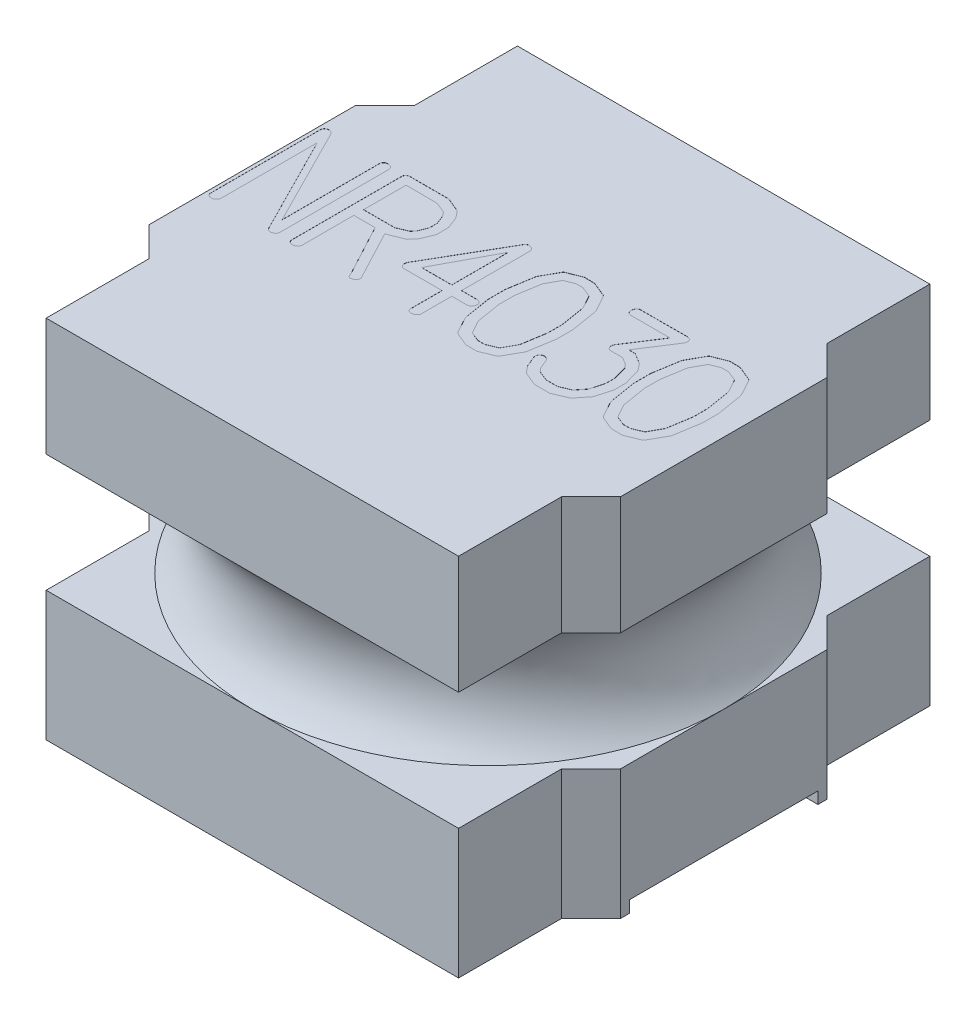
from build123d import *

# Parameters (mm, degrees)
BOSS_EXTRUDE1_START = -1.5
BOSS_EXTRUDE1_DEPTH = 1
CUT_EXTRUDE1_DEPTH  = 0.001
BOSS_EXTRUDE2_DEPTH = 0.1


with BuildPart() as part:
    # Sketch1 → Boss-Extrude1 (new body)
    with BuildSketch(Plane(origin=(0, 0, 0), x_dir=(1, 0, 0), z_dir=(0, 1, 0)).offset(BOSS_EXTRUDE1_START)):
        Polygon((-1.75, 2), (1.75, 2), (1.75, 1.125), (2, 0.875), (2, -0.875), (1.75, -1.125), (1.75, -2), (-1.75, -2), (-1.75, -1.125), (-2, -0.875), (-2, 0.875), (-1.75, 1.125), align=None)
    boss_extrude1 = extrude(amount=BOSS_EXTRUDE1_DEPTH)

    # Sketch2 → Revolve1 (revolve)
    with BuildSketch(Plane(origin=(0, 0, 0), x_dir=(0, 0, -1), z_dir=(1, 0, 0))):
        with BuildLine():
            Line((-2, 0.5), (0, 0.5))
            Line((0, 0.5), (0, -0.5))
            Line((0, -0.5), (-2, -0.5))
            ThreePointArc((-2, -0.5), (-1.809016994, 0), (-2, 0.5))
        make_face()
    revolve(axis=Axis((0, -1.5, 0), (0, 1, 0)))

    # Mirror1: Boss-Extrude1 across plane
    add(boss_extrude1.mirror(Plane.ZX))

    # Sketch3 → Cut-Extrude1 (cut)
    # profile 1 of 6: a face of its own
    with BuildSketch(Plane(origin=(0, 1.5, 0), x_dir=(1, 0, 0), z_dir=(0, 1, 0))):
        with BuildLine():
            Line((-1.896763393, 0.565182545), (-1.47172619, -0.275777276))
            Line((-1.47172619, -0.275777276), (-1.47172619, 0.556439986))
            add(Edge.make_bspline(
                [(-1.47172619, 0.556439986), (-1.470306395, 0.560142119), (-1.467630722, 0.567118969), (-1.460760161, 0.575623855), (-1.452434536, 0.581976469), (-1.445838877, 0.583797906), (-1.442522321, 0.584713795)],
                knots=[0, 0, 0, 0, 1.109185066, 2.09031286, 3.039734632, 4, 4, 4, 4], degree=3))
            add(Edge.make_bspline(
                [(-1.442522321, 0.584713795), (-1.436038113, 0.584478157), (-1.424379293, 0.584054471), (-1.408951724, 0.580032187), (-1.397195814, 0.572686768), (-1.393633727, 0.565223886), (-1.391927083, 0.561648319)],
                knots=[0, 0, 0, 0, 1.309736388, 2.354949205, 3.211834253, 4, 4, 4, 4], degree=3))
            Line((-1.391927083, 0.561648319), (-1.388392857, 0.549557545))
            Line((-1.388392857, 0.549557545), (-1.388392857, -0.383478169))
            add(Edge.make_bspline(
                [(-1.388392857, -0.383478169), (-1.389803322, -0.387527534), (-1.392568979, -0.395467575), (-1.401548089, -0.405193133), (-1.413923051, -0.411867685), (-1.423471144, -0.414095942), (-1.428571429, -0.415286205)],
                knots=[0, 0, 0, 0, 0.93883371, 1.840875961, 2.846665492, 4, 4, 4, 4], degree=3))
            add(Edge.make_bspline(
                [(-1.428571429, -0.415286205), (-1.432188471, -0.415176507), (-1.438883743, -0.414973452), (-1.447870125, -0.412720635), (-1.455385705, -0.409366324), (-1.458511029, -0.405444995), (-1.46000744, -0.403567455)],
                knots=[0, 0, 0, 0, 1.240813366, 2.296788812, 3.184498919, 4, 4, 4, 4], degree=3))
            Line((-1.46000744, -0.403567455), (-1.466517857, -0.394452871))
            Line((-1.466517857, -0.394452871), (-1.888392857, 0.439066474))
            Line((-1.888392857, 0.439066474), (-1.888392857, -0.381804062))
            add(Edge.make_bspline(
                [(-1.888392857, -0.381804062), (-1.889479385, -0.384979641), (-1.891736312, -0.391575932), (-1.898454551, -0.400472129), (-1.907811787, -0.408500211), (-1.915283117, -0.412924698), (-1.919270833, -0.415286205)],
                knots=[0, 0, 0, 0, 0.855881606, 1.777831308, 2.813949167, 4, 4, 4, 4], degree=3))
            Line((-1.919270833, -0.415286205), (-1.936011905, -0.415286205))
            add(Edge.make_bspline(
                [(-1.936011905, -0.415286205), (-1.938636346, -0.415227468), (-1.943726483, -0.415113546), (-1.950770904, -0.41286715), (-1.957229509, -0.410001889), (-1.962385618, -0.405405544), (-1.966543861, -0.399955988), (-1.969492153, -0.393737282), (-1.971498185, -0.386887024), (-1.971648412, -0.382067298), (-1.97172619, -0.379571919)],
                knots=[0, 0, 0, 0, 1.101665817, 2.136695196, 3.096220978, 4.06108244, 5.013447482, 5.972973263, 6.950521542, 8, 8, 8, 8], degree=3))
            Line((-1.97172619, -0.379571919), (-1.97172619, 0.554765879))
            add(Edge.make_bspline(
                [(-1.97172619, 0.554765879), (-1.970424232, 0.558274857), (-1.967871956, 0.56515363), (-1.960801213, 0.573792575), (-1.951543686, 0.58051624), (-1.944281464, 0.583270574), (-1.94047619, 0.584713795)],
                knots=[0, 0, 0, 0, 0.990101851, 1.940931574, 2.921085177, 4, 4, 4, 4], degree=3))
            add(Edge.make_bspline(
                [(-1.94047619, 0.584713795), (-1.936111566, 0.584449349), (-1.927664385, 0.583937548), (-1.915640252, 0.580381328), (-1.905043333, 0.574120683), (-1.899546284, 0.568186656), (-1.896763393, 0.565182545)],
                knots=[0, 0, 0, 0, 1.057654734, 2.046957308, 3.011268782, 4, 4, 4, 4], degree=3))
        make_face()
    # profile 2 of 6: a face of its own
    with BuildSketch(Plane(origin=(0, 1.5, 0), x_dir=(1, 0, 0), z_dir=(0, 1, 0))):
        with BuildLine():
            add(Edge.make_bspline(
                [(-0.916220238, 0.584713795), (-0.912819184, 0.583142877), (-0.905559586, 0.579789729), (-0.89386605, 0.574930794), (-0.881004782, 0.569184691), (-0.866662817, 0.563360852), (-0.851012308, 0.556763425), (-0.833973993, 0.54981334), (-0.815704558, 0.542046263), (-0.803010382, 0.53694798), (-0.796428571, 0.534304569)],
                knots=[0, 0, 0, 0, 0.69170389, 1.476452024, 2.33788276, 3.292567323, 4.33444127, 5.47407891, 6.69033371, 8, 8, 8, 8], degree=3))
            add(Edge.make_bspline(
                [(-0.796428571, 0.534304569), (-0.795365255, 0.533196905), (-0.792871733, 0.530599387), (-0.788930193, 0.52599228), (-0.783955072, 0.520404772), (-0.778535116, 0.513460678), (-0.771870613, 0.505651651), (-0.764518356, 0.496576426), (-0.75632609, 0.48635153), (-0.750662632, 0.479126604), (-0.747693452, 0.475338795)],
                knots=[0, 0, 0, 0, 0.481485898, 1.129104191, 1.901129329, 2.827469681, 3.890672923, 5.120764969, 6.490504369, 8, 8, 8, 8], degree=3))
            Line((-0.747693452, 0.475338795), (-0.708630952, 0.375636414))
            add(Edge.make_bspline(
                [(-0.708630952, 0.375636414), (-0.708442783, 0.369250132), (-0.708022631, 0.354990646), (-0.707378502, 0.33130738), (-0.707353284, 0.303153309), (-0.707216213, 0.282878298), (-0.707142857, 0.272027783)],
                knots=[0, 0, 0, 0, 0.739877275, 1.652020808, 2.743439316, 4, 4, 4, 4], degree=3))
            add(Edge.make_bspline(
                [(-0.707142857, 0.272027783), (-0.708833753, 0.268066448), (-0.712414149, 0.259678499), (-0.7177127, 0.246282734), (-0.723686208, 0.231596438), (-0.729956446, 0.216247789), (-0.735895517, 0.2014471), (-0.740808214, 0.188334392), (-0.745137178, 0.177862838), (-0.747576349, 0.171646102), (-0.748623512, 0.168977188)],
                knots=[0, 0, 0, 0, 0.930477767, 1.970244378, 3.112005238, 4.355764031, 5.552241039, 6.557257016, 7.380614275, 8, 8, 8, 8], degree=3))
            Line((-0.748623512, 0.168977188), (-0.796056548, 0.112615581))
            Line((-0.796056548, 0.112615581), (-0.802380952, 0.108523319))
            Line((-0.802380952, 0.108523319), (-0.918452381, 0.060904271))
            Line((-0.918452381, 0.060904271), (-0.93500744, 0.060904271))
            Line((-0.93500744, 0.060904271), (-0.71235119, -0.359668645))
            add(Edge.make_bspline(
                [(-0.71235119, -0.359668645), (-0.710840542, -0.362518567), (-0.708167134, -0.367562101), (-0.70745332, -0.373209441), (-0.707142857, -0.375665669)],
                knots=[0, 0, 0, 0, 1.130128936, 2, 2, 2, 2], degree=3))
            add(Edge.make_bspline(
                [(-0.707142857, -0.375665669), (-0.707288041, -0.379102057), (-0.707558426, -0.385501872), (-0.710834301, -0.390984218), (-0.71235119, -0.393522812)],
                knots=[0, 0, 0, 0, 1.073902397, 2, 2, 2, 2], degree=3))
            add(Edge.make_bspline(
                [(-0.71235119, -0.393522812), (-0.714349654, -0.396902888), (-0.718452493, -0.403842171), (-0.729761392, -0.410547182), (-0.743987225, -0.414627787), (-0.754660614, -0.414932615), (-0.760528274, -0.415100193)],
                knots=[0, 0, 0, 0, 0.833397318, 1.710961782, 2.741608977, 4, 4, 4, 4], degree=3))
            add(Edge.make_bspline(
                [(-0.760528274, -0.415100193), (-0.763007493, -0.413961421), (-0.768484487, -0.41144569), (-0.774695764, -0.403152782), (-0.780230676, -0.39201179), (-0.7828736, -0.383168872), (-0.784337798, -0.378269836)],
                knots=[0, 0, 0, 0, 0.710807694, 1.570288236, 2.65392335, 4, 4, 4, 4], degree=3))
            Line((-0.784337798, -0.378269836), (-1.019084821, 0.060904271))
            Line((-1.019084821, 0.060904271), (-1.199702381, 0.060904271))
            Line((-1.199702381, 0.060904271), (-1.199702381, -0.381990074))
            add(Edge.make_bspline(
                [(-1.199702381, -0.381990074), (-1.200703143, -0.385179467), (-1.202800313, -0.391863072), (-1.209811821, -0.400575425), (-1.219115439, -0.408814022), (-1.226813628, -0.413023225), (-1.230952381, -0.415286205)],
                knots=[0, 0, 0, 0, 0.845387553, 1.771571109, 2.801936792, 4, 4, 4, 4], degree=3))
            Line((-1.230952381, -0.415286205), (-1.247321429, -0.415286205))
            add(Edge.make_bspline(
                [(-1.247321429, -0.415286205), (-1.24994587, -0.415227468), (-1.255036007, -0.415113546), (-1.262080428, -0.41286715), (-1.268539033, -0.410001889), (-1.273695142, -0.405405544), (-1.277853385, -0.399955988), (-1.280801676, -0.393737282), (-1.282807708, -0.386887024), (-1.282957935, -0.382067298), (-1.283035714, -0.379571919)],
                knots=[0, 0, 0, 0, 1.101665817, 2.136695196, 3.096220978, 4.06108244, 5.013447482, 5.972973263, 6.950521542, 8, 8, 8, 8], degree=3))
            Line((-1.283035714, -0.379571919), (-1.283035714, 0.55588195))
            add(Edge.make_bspline(
                [(-1.283035714, 0.55588195), (-1.281821214, 0.559642222), (-1.279498142, 0.566834794), (-1.272703477, 0.575716703), (-1.263696193, 0.582136738), (-1.256595062, 0.583832062), (-1.252901786, 0.584713795)],
                knots=[0, 0, 0, 0, 1.064767976, 2.036666745, 2.978876548, 4, 4, 4, 4], degree=3))
            Line((-1.252901786, 0.584713795), (-0.916220238, 0.584713795))
        make_face()
        Polygon((-0.843861607, 0.466224212), (-0.934077381, 0.503054569), (-1.199702381, 0.504356652), (-1.199702381, 0.144237605), (-0.935379464, 0.144237605), (-0.843861607, 0.183300105), (-0.818377976, 0.214178081), (-0.787686012, 0.289698914), (-0.787686012, 0.357593259), (-0.818377976, 0.433114093), align=None, mode=Mode.SUBTRACT)
    # profile 3 of 6: a face of its own
    with BuildSketch(Plane(origin=(0, 1.5, 0), x_dir=(1, 0, 0), z_dir=(0, 1, 0))):
        with BuildLine():
            Line((-0.194233631, 0.561648319), (-0.189583333, 0.548813498))
            Line((-0.189583333, 0.548813498), (-0.189583333, -0.034333824))
            Line((-0.189583333, -0.034333824), (-0.055654762, -0.034519836))
            add(Edge.make_bspline(
                [(-0.055654762, -0.034519836), (-0.0505191, -0.035845237), (-0.04111382, -0.038272532), (-0.029358132, -0.045828156), (-0.021335425, -0.0563029), (-0.019798957, -0.064648792), (-0.019010417, -0.068932038)],
                knots=[0, 0, 0, 0, 1.169459646, 2.1417093, 3.046295384, 4, 4, 4, 4], degree=3))
            add(Edge.make_bspline(
                [(-0.019010417, -0.068932038), (-0.019167329, -0.072921736), (-0.019468311, -0.080574575), (-0.022363141, -0.091357533), (-0.026905325, -0.101037212), (-0.031695085, -0.106056245), (-0.034077381, -0.108552574)],
                knots=[0, 0, 0, 0, 1.095690159, 2.101697989, 3.055836587, 4, 4, 4, 4], degree=3))
            Line((-0.034077381, -0.108552574), (-0.051934524, -0.117667157))
            Line((-0.051934524, -0.117667157), (-0.189583333, -0.117667157))
            Line((-0.189583333, -0.117667157), (-0.189583333, -0.38161805))
            add(Edge.make_bspline(
                [(-0.189583333, -0.38161805), (-0.190501795, -0.384590956), (-0.19227155, -0.390319359), (-0.197093909, -0.397779375), (-0.203390314, -0.403784099), (-0.213173772, -0.40882583), (-0.224427688, -0.413148332), (-0.233393179, -0.414648726), (-0.237202381, -0.415286205)],
                knots=[0, 0, 0, 0, 0.895387976, 1.725295879, 2.536428694, 3.378620822, 4.886244683, 6, 6, 6, 6], degree=3))
            add(Edge.make_bspline(
                [(-0.237202381, -0.415286205), (-0.24000098, -0.415192141), (-0.245283265, -0.415014598), (-0.252686607, -0.413360266), (-0.258920132, -0.410530043), (-0.264244805, -0.406754867), (-0.26812442, -0.401568245), (-0.271025447, -0.395380956), (-0.272624796, -0.388083341), (-0.272816283, -0.382865378), (-0.272916667, -0.380129955)],
                knots=[0, 0, 0, 0, 1.168965484, 2.206392299, 3.145950951, 4.016860765, 4.903443245, 5.819468469, 6.856895284, 8, 8, 8, 8], degree=3))
            Line((-0.272916667, -0.380129955), (-0.272916667, -0.117667157))
            Line((-0.272916667, -0.117667157), (-0.600855655, -0.117667157))
            add(Edge.make_bspline(
                [(-0.600855655, -0.117667157), (-0.60441803, -0.116705645), (-0.611342046, -0.114836799), (-0.620277979, -0.108291522), (-0.626486277, -0.098628148), (-0.62881918, -0.091141604), (-0.630059524, -0.087161205)],
                knots=[0, 0, 0, 0, 0.981167136, 1.907046662, 2.887231297, 4, 4, 4, 4], degree=3))
            Line((-0.630059524, -0.087161205), (-0.630059524, -0.077674598))
            add(Edge.make_bspline(
                [(-0.630059524, -0.077674598), (-0.629803534, -0.073068197), (-0.629294815, -0.063914094), (-0.625207591, -0.055709114), (-0.623177083, -0.051632931)],
                knots=[0, 0, 0, 0, 1.00641232, 2, 2, 2, 2], degree=3))
            Line((-0.623177083, -0.051632931), (-0.580766369, 0.020911712))
            Line((-0.580766369, 0.020911712), (-0.261755952, 0.572437009))
            add(Edge.make_bspline(
                [(-0.261755952, 0.572437009), (-0.259564783, 0.5742872), (-0.255479413, 0.577736826), (-0.249078974, 0.581859249), (-0.242633996, 0.584225878), (-0.238334685, 0.584555619), (-0.236272321, 0.584713795)],
                knots=[0, 0, 0, 0, 1.18923455, 2.217292782, 3.144841935, 4, 4, 4, 4], degree=3))
            add(Edge.make_bspline(
                [(-0.236272321, 0.584713795), (-0.234404977, 0.5845061), (-0.230576814, 0.584080314), (-0.226839751, 0.583146151), (-0.224925595, 0.582667664)],
                knots=[0, 0, 0, 0, 0.975582543, 2, 2, 2, 2], degree=3))
            add(Edge.make_bspline(
                [(-0.224925595, 0.582667664), (-0.220883993, 0.581673517), (-0.213537628, 0.579866468), (-0.204408508, 0.574859942), (-0.197380358, 0.569136499), (-0.195246675, 0.564059032), (-0.194233631, 0.561648319)],
                knots=[0, 0, 0, 0, 1.277997596, 2.322998947, 3.203782403, 4, 4, 4, 4], degree=3))
        make_face()
        Polygon((-0.527938988, -0.034333824), (-0.272916667, -0.034333824), (-0.272916667, 0.444460819), align=None, mode=Mode.SUBTRACT)
    # profile 4 of 6: a face of its own
    with BuildSketch(Plane(origin=(0, 1.5, 0), x_dir=(1, 0, 0), z_dir=(0, 1, 0))):
        with BuildLine():
            add(Edge.make_bspline(
                [(0.322767857, 0.583039688), (0.326173058, 0.581539845), (0.333519924, 0.57830387), (0.345352397, 0.573403138), (0.358592366, 0.567664507), (0.373482234, 0.561912306), (0.389655505, 0.555102658), (0.407338652, 0.547784533), (0.426678355, 0.540329583), (0.439965264, 0.534887365), (0.446837798, 0.532072426)],
                knots=[0, 0, 0, 0, 0.665720275, 1.436320058, 2.291406459, 3.247277281, 4.291804095, 5.431067394, 6.671242782, 8, 8, 8, 8], degree=3))
            Line((0.446837798, 0.532072426), (0.458928571, 0.517563498))
            Line((0.458928571, 0.517563498), (0.530543155, 0.384937009))
            Line((0.530543155, 0.384937009), (0.534635417, 0.370986117))
            Line((0.534635417, 0.370986117), (0.570535714, 0.150189986))
            Line((0.570535714, 0.150189986), (0.570535714, 0.012727188))
            Line((0.570535714, 0.012727188), (0.533333333, -0.213463288))
            Line((0.533333333, -0.213463288), (0.530357143, -0.21755555))
            Line((0.530357143, -0.21755555), (0.451116071, -0.35911061))
            Line((0.451116071, -0.35911061), (0.443861607, -0.365249002))
            add(Edge.make_bspline(
                [(0.443861607, -0.365249002), (0.439383629, -0.36676168), (0.429864848, -0.369977158), (0.41494761, -0.375927253), (0.398238292, -0.382547328), (0.380533743, -0.389936864), (0.363037839, -0.39729067), (0.347226445, -0.404193145), (0.33350565, -0.409898418), (0.325241332, -0.413596661), (0.321465774, -0.415286205)],
                knots=[0, 0, 0, 0, 0.857514317, 1.822807192, 2.913398912, 4.118988428, 5.303819582, 6.357154914, 7.249465436, 8, 8, 8, 8], degree=3))
            Line((0.321465774, -0.415286205), (0.228087798, -0.415286205))
            add(Edge.make_bspline(
                [(0.228087798, -0.415286205), (0.220569275, -0.412411992), (0.203961657, -0.406063162), (0.177016278, -0.394651666), (0.145230402, -0.381628066), (0.12260421, -0.371918981), (0.110528274, -0.366737098)],
                knots=[0, 0, 0, 0, 0.759314602, 1.677245352, 2.760311232, 4, 4, 4, 4], degree=3))
            Line((0.110528274, -0.366737098), (0.100111607, -0.356134419))
            Line((0.100111607, -0.356134419), (0.025892857, -0.218113586))
            Line((0.025892857, -0.218113586), (0.023102679, -0.207882931))
            Line((0.023102679, -0.207882931), (-0.012797619, 0.014773319))
            Line((-0.012797619, 0.014773319), (-0.012797619, 0.159490581))
            Line((-0.012797619, 0.159490581), (0.023474702, 0.382146831))
            Line((0.023474702, 0.382146831), (0.02719494, 0.39181945))
            Line((0.02719494, 0.39181945), (0.102529762, 0.527050105))
            Line((0.102529762, 0.527050105), (0.112388393, 0.536722724))
            add(Edge.make_bspline(
                [(0.112388393, 0.536722724), (0.116307082, 0.538053111), (0.124947841, 0.540986631), (0.138756573, 0.546577625), (0.155077767, 0.552543385), (0.17269281, 0.559762622), (0.190316997, 0.567220509), (0.206694697, 0.573528655), (0.220684727, 0.579441596), (0.229323774, 0.582925729), (0.233296131, 0.584527783)],
                knots=[0, 0, 0, 0, 0.76366452, 1.683889708, 2.748731425, 3.970665397, 5.196932387, 6.280730219, 7.209455205, 8, 8, 8, 8], degree=3))
            Line((0.233296131, 0.584527783), (0.322767857, 0.583039688))
        make_face()
        Polygon((0.39140625, 0.466968259), (0.30453869, 0.501380462), (0.245572917, 0.501380462), (0.165215774, 0.468642367), (0.103831845, 0.357407248), (0.070535714, 0.15260814), (0.070535714, 0.021841771), (0.104947917, -0.187049598), (0.166331845, -0.299400788), (0.245386905, -0.331952871), (0.303980655, -0.331952871), (0.392522321, -0.294936502), (0.454092262, -0.183515371), (0.487202381, 0.021841771), (0.487202381, 0.142563498), (0.45297619, 0.354059033), align=None, mode=Mode.SUBTRACT)
    # profile 5 of 6: a face of its own
    with BuildSketch(Plane(origin=(0, 1.5, 0), x_dir=(1, 0, 0), z_dir=(0, 1, 0))):
        with BuildLine():
            add(Edge.make_bspline(
                [(1.146130952, 0.545465283), (1.145966982, 0.543463528), (1.145598806, 0.538968833), (1.142876033, 0.531946606), (1.138973509, 0.523915999), (1.135527522, 0.518460835), (1.133668155, 0.515517367)],
                knots=[0, 0, 0, 0, 0.731496768, 1.642485333, 2.72794448, 4, 4, 4, 4], degree=3))
            add(Edge.make_bspline(
                [(1.133668155, 0.515517367), (1.131679496, 0.512354181), (1.128392186, 0.507125346), (1.126340565, 0.503939229), (1.122508292, 0.497825042), (1.123371227, 0.498708449), (1.1234375, 0.498776295)],
                knots=[0, 0, 0, 0, 2.008375184, 3.31990065, 3.947768297, 4, 4, 4, 4], degree=3))
            Line((1.1234375, 0.498776295), (0.955840774, 0.2394757))
            Line((0.955840774, 0.2394757), (1.00922619, 0.2394757))
            add(Edge.make_bspline(
                [(1.00922619, 0.2394757), (1.014874125, 0.236136807), (1.027442324, 0.228706856), (1.048111917, 0.216177336), (1.072622951, 0.201288147), (1.090321772, 0.190669302), (1.099813988, 0.184974212)],
                knots=[0, 0, 0, 0, 0.744723836, 1.65721417, 2.743519113, 4, 4, 4, 4], degree=3))
            Line((1.099813988, 0.184974212), (1.13999256, 0.136053081))
            add(Edge.make_bspline(
                [(1.13999256, 0.136053081), (1.141094935, 0.134531506), (1.143697635, 0.130939082), (1.146767237, 0.123979408), (1.1504111, 0.115234897), (1.15245495, 0.108608723), (1.153571429, 0.104989093)],
                knots=[0, 0, 0, 0, 0.660434001, 1.559278996, 2.666725834, 4, 4, 4, 4], degree=3))
            add(Edge.make_bspline(
                [(1.153571429, 0.104989093), (1.155674377, 0.097423155), (1.16034781, 0.080609187), (1.168202323, 0.052843165), (1.17749544, 0.019916962), (1.184199629, -0.003766363), (1.187797619, -0.016476681)],
                knots=[0, 0, 0, 0, 0.746719963, 1.659454107, 2.743880703, 4, 4, 4, 4], degree=3))
            Line((1.187797619, -0.016476681), (1.187797619, -0.115435014))
            add(Edge.make_bspline(
                [(1.187797619, -0.115435014), (1.183981622, -0.128880564), (1.176691243, -0.154567995), (1.166787961, -0.191471332), (1.157492077, -0.224747523), (1.152051218, -0.245882764), (1.149479167, -0.255874002)],
                knots=[0, 0, 0, 0, 1.152088605, 2.201040242, 3.149579839, 4, 4, 4, 4], degree=3))
            add(Edge.make_bspline(
                [(1.149479167, -0.255874002), (1.148307478, -0.257490819), (1.145345512, -0.261578044), (1.139781751, -0.26878772), (1.13200663, -0.27823063), (1.122713436, -0.290451238), (1.110763051, -0.304562996), (1.097603618, -0.321703154), (1.081819807, -0.34069679), (1.070839086, -0.354320941), (1.065029762, -0.361528764)],
                knots=[0, 0, 0, 0, 0.354260306, 0.895550937, 1.615424868, 2.52432519, 3.618802696, 4.895348182, 6.357491474, 8, 8, 8, 8], degree=3))
            add(Edge.make_bspline(
                [(1.065029762, -0.361528764), (1.060515732, -0.36366402), (1.050930409, -0.368198131), (1.035375925, -0.37484548), (1.017979567, -0.382107947), (0.999316539, -0.389396593), (0.980982174, -0.396451597), (0.964686447, -0.40331462), (0.950984084, -0.409468379), (0.942811076, -0.413469356), (0.939099702, -0.415286205)],
                knots=[0, 0, 0, 0, 0.874918988, 1.85784809, 2.963529072, 4.178080018, 5.368433221, 6.405587914, 7.27597554, 8, 8, 8, 8], degree=3))
            Line((0.939099702, -0.415286205), (0.808891369, -0.415286205))
            add(Edge.make_bspline(
                [(0.808891369, -0.415286205), (0.80162127, -0.412472525), (0.785512274, -0.406238008), (0.759311799, -0.39501506), (0.728268688, -0.382178249), (0.706136242, -0.372600021), (0.694308036, -0.367481145)],
                knots=[0, 0, 0, 0, 0.753366235, 1.669299668, 2.754407724, 4, 4, 4, 4], degree=3))
            add(Edge.make_bspline(
                [(0.694308036, -0.367481145), (0.693486673, -0.366752221), (0.691416109, -0.364914684), (0.688196758, -0.361066912), (0.683628916, -0.356078826), (0.678140798, -0.349547589), (0.671426694, -0.341751415), (0.663569559, -0.33261239), (0.654701117, -0.322072569), (0.648480483, -0.314535259), (0.645200893, -0.310561502)],
                knots=[0, 0, 0, 0, 0.350081131, 0.882515176, 1.597343563, 2.509514018, 3.604118565, 4.881157203, 6.35571015, 8, 8, 8, 8], degree=3))
            Line((0.645200893, -0.310561502), (0.604464286, -0.213835312))
            Line((0.604464286, -0.213835312), (0.604464286, -0.203418645))
            add(Edge.make_bspline(
                [(0.604464286, -0.203418645), (0.604783998, -0.198378384), (0.605390145, -0.18882248), (0.6105721, -0.180797268), (0.613020833, -0.177004955)],
                knots=[0, 0, 0, 0, 1.054899985, 2, 2, 2, 2], degree=3))
            add(Edge.make_bspline(
                [(0.613020833, -0.177004955), (0.615484388, -0.174962741), (0.620435161, -0.170858695), (0.629456985, -0.166810099), (0.6394831, -0.16431489), (0.646548635, -0.164097289), (0.650223214, -0.163984121)],
                knots=[0, 0, 0, 0, 0.947468225, 1.904037492, 2.909950893, 4, 4, 4, 4], degree=3))
            add(Edge.make_bspline(
                [(0.650223214, -0.163984121), (0.654167331, -0.16557506), (0.661437519, -0.168507636), (0.670865793, -0.173685002), (0.677744265, -0.179774907), (0.680287127, -0.18460885), (0.681473214, -0.186863586)],
                knots=[0, 0, 0, 0, 1.28205388, 2.363209, 3.236538274, 4, 4, 4, 4], degree=3))
            Line((0.681473214, -0.186863586), (0.715885417, -0.269452871))
            Line((0.715885417, -0.269452871), (0.741741071, -0.298656741))
            Line((0.741741071, -0.298656741), (0.825074405, -0.331952871))
            Line((0.825074405, -0.331952871), (0.921056548, -0.331952871))
            Line((0.921056548, -0.331952871), (1.012202381, -0.294192455))
            Line((1.012202381, -0.294192455), (1.072098214, -0.220903764))
            Line((1.072098214, -0.220903764), (1.104464286, -0.102972217))
            Line((1.104464286, -0.102972217), (1.104464286, -0.027823407))
            Line((1.104464286, -0.027823407), (1.072842262, 0.088248021))
            Line((1.072842262, 0.088248021), (1.045126488, 0.120614093))
            Line((1.045126488, 0.120614093), (0.985602679, 0.156142367))
            Line((0.985602679, 0.156142367), (0.879575893, 0.156142367))
            add(Edge.make_bspline(
                [(0.879575893, 0.156142367), (0.875780938, 0.157371714), (0.868398763, 0.159763115), (0.859661952, 0.167748587), (0.85380116, 0.17841488), (0.85241469, 0.186570347), (0.851674107, 0.190926593)],
                knots=[0, 0, 0, 0, 0.993260278, 1.932149966, 2.895457034, 4, 4, 4, 4], degree=3))
            add(Edge.make_bspline(
                [(0.851674107, 0.190926593), (0.851758519, 0.196174182), (0.851907411, 0.205430218), (0.855898217, 0.213741133), (0.857626488, 0.217340283)],
                knots=[0, 0, 0, 0, 1.133873875, 2, 2, 2, 2], degree=3))
            Line((0.857626488, 0.217340283), (1.041964286, 0.501380462))
            Line((1.041964286, 0.501380462), (0.703980655, 0.501380462))
            add(Edge.make_bspline(
                [(0.703980655, 0.501380462), (0.700479643, 0.502415304), (0.693604631, 0.504447447), (0.684743659, 0.511150916), (0.67846783, 0.521005042), (0.676304048, 0.528705313), (0.67514881, 0.532816474)],
                knots=[0, 0, 0, 0, 0.961552233, 1.888220791, 2.872524955, 4, 4, 4, 4], degree=3))
            add(Edge.make_bspline(
                [(0.67514881, 0.532816474), (0.675331973, 0.537925971), (0.675671285, 0.547391371), (0.678893736, 0.560381971), (0.683923761, 0.571314117), (0.689302235, 0.576593477), (0.691889881, 0.579133438)],
                knots=[0, 0, 0, 0, 1.204793626, 2.231893546, 3.149343424, 4, 4, 4, 4], degree=3))
            Line((0.691889881, 0.579133438), (0.703050595, 0.5832257))
            Line((0.703050595, 0.5832257), (1.095349702, 0.584713795))
            add(Edge.make_bspline(
                [(1.095349702, 0.584713795), (1.099325852, 0.584637454), (1.106771215, 0.584494505), (1.117200648, 0.582657804), (1.126072565, 0.579497122), (1.133480781, 0.575246819), (1.139438302, 0.569679813), (1.143264993, 0.562538599), (1.145821127, 0.554381007), (1.14602462, 0.548525174), (1.146130952, 0.545465283)],
                knots=[0, 0, 0, 0, 1.302296161, 2.438557397, 3.454453739, 4.374755197, 5.222865942, 6.087619718, 7.000710084, 8, 8, 8, 8], degree=3))
        make_face()
    # profile 6 of 6: a face of its own
    with BuildSketch(Plane(origin=(0, 1.5, 0), x_dir=(1, 0, 0), z_dir=(0, 1, 0))):
        with BuildLine():
            add(Edge.make_bspline(
                [(1.557291667, 0.583039688), (1.560696867, 0.581539845), (1.568043734, 0.57830387), (1.579876207, 0.573403138), (1.593116175, 0.567664507), (1.608006044, 0.561912306), (1.624179314, 0.555102658), (1.641862461, 0.547784533), (1.661202164, 0.540329583), (1.674489073, 0.534887365), (1.681361607, 0.532072426)],
                knots=[0, 0, 0, 0, 0.665720275, 1.436320058, 2.291406459, 3.247277281, 4.291804095, 5.431067394, 6.671242782, 8, 8, 8, 8], degree=3))
            Line((1.681361607, 0.532072426), (1.693452381, 0.517563498))
            Line((1.693452381, 0.517563498), (1.765066964, 0.384937009))
            Line((1.765066964, 0.384937009), (1.769159226, 0.370986117))
            Line((1.769159226, 0.370986117), (1.805059524, 0.150189986))
            Line((1.805059524, 0.150189986), (1.805059524, 0.012727188))
            Line((1.805059524, 0.012727188), (1.767857143, -0.213463288))
            Line((1.767857143, -0.213463288), (1.764880952, -0.21755555))
            Line((1.764880952, -0.21755555), (1.685639881, -0.35911061))
            Line((1.685639881, -0.35911061), (1.678385417, -0.365249002))
            add(Edge.make_bspline(
                [(1.678385417, -0.365249002), (1.673907438, -0.36676168), (1.664388658, -0.369977158), (1.64947142, -0.375927253), (1.632762102, -0.382547328), (1.615057552, -0.389936864), (1.597561649, -0.39729067), (1.581750255, -0.404193145), (1.568029459, -0.409898418), (1.559765141, -0.413596661), (1.555989583, -0.415286205)],
                knots=[0, 0, 0, 0, 0.857514317, 1.822807192, 2.913398912, 4.118988428, 5.303819582, 6.357154914, 7.249465436, 8, 8, 8, 8], degree=3))
            Line((1.555989583, -0.415286205), (1.462611607, -0.415286205))
            add(Edge.make_bspline(
                [(1.462611607, -0.415286205), (1.455093085, -0.412411992), (1.438485467, -0.406063162), (1.411540087, -0.394651666), (1.379754212, -0.381628066), (1.357128019, -0.371918981), (1.345052083, -0.366737098)],
                knots=[0, 0, 0, 0, 0.759314602, 1.677245352, 2.760311232, 4, 4, 4, 4], degree=3))
            Line((1.345052083, -0.366737098), (1.334635417, -0.356134419))
            Line((1.334635417, -0.356134419), (1.260416667, -0.218113586))
            Line((1.260416667, -0.218113586), (1.257626488, -0.207882931))
            Line((1.257626488, -0.207882931), (1.22172619, 0.014773319))
            Line((1.22172619, 0.014773319), (1.22172619, 0.159490581))
            Line((1.22172619, 0.159490581), (1.257998512, 0.382146831))
            Line((1.257998512, 0.382146831), (1.26171875, 0.39181945))
            Line((1.26171875, 0.39181945), (1.337053571, 0.527050105))
            Line((1.337053571, 0.527050105), (1.346912202, 0.536722724))
            add(Edge.make_bspline(
                [(1.346912202, 0.536722724), (1.350830892, 0.538053111), (1.359471651, 0.540986631), (1.373280382, 0.546577625), (1.389601577, 0.552543385), (1.40721662, 0.559762622), (1.424840806, 0.567220509), (1.441218507, 0.573528655), (1.455208536, 0.579441596), (1.463847583, 0.582925729), (1.46781994, 0.584527783)],
                knots=[0, 0, 0, 0, 0.76366452, 1.683889708, 2.748731425, 3.970665397, 5.196932387, 6.280730219, 7.209455205, 8, 8, 8, 8], degree=3))
            Line((1.46781994, 0.584527783), (1.557291667, 0.583039688))
        make_face()
        Polygon((1.62593006, 0.466968259), (1.5390625, 0.501380462), (1.480096726, 0.501380462), (1.399739583, 0.468642367), (1.338355655, 0.357407248), (1.305059524, 0.15260814), (1.305059524, 0.021841771), (1.339471726, -0.187049598), (1.400855655, -0.299400788), (1.479910714, -0.331952871), (1.538504464, -0.331952871), (1.627046131, -0.294936502), (1.688616071, -0.183515371), (1.72172619, 0.021841771), (1.72172619, 0.142563498), (1.6875, 0.354059033), align=None, mode=Mode.SUBTRACT)
    extrude(amount=-CUT_EXTRUDE1_DEPTH, mode=Mode.SUBTRACT)

    # Sketch4 → Boss-Extrude2 (add)
    with BuildSketch(Plane.XZ.offset(1.5)):
        Polygon((-2, 0.8), (2, 0.8), (2, 0.875), (1.75, 1.125), (1.75, 2), (-1.75, 2), (-1.75, 1.125), (-2, 0.875), align=None)
        Polygon((-1.75, -1.125), (-2, -0.875), (-2, -0.8), (2, -0.8), (2, -0.875), (1.75, -1.125), (1.75, -2), (-1.75, -2), align=None)
    extrude(amount=BOSS_EXTRUDE2_DEPTH)


solid = part.part
